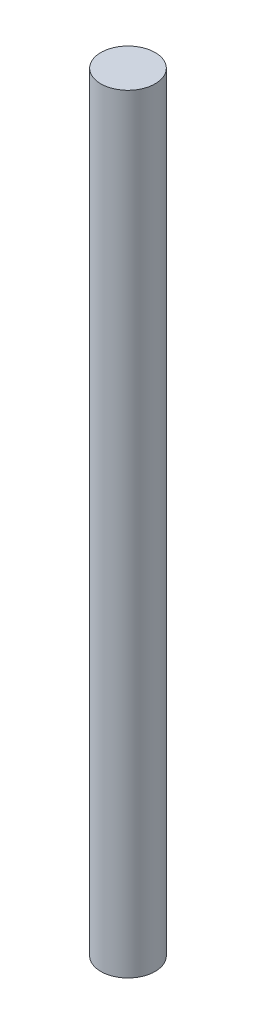
from build123d import *

# Parameters (mm, degrees)
SKETCH1_R           = 6
BOSS_EXTRUDE1_DEPTH = 170


with BuildPart() as part:
    # Sketch1 → Boss-Extrude1 (new body)
    with BuildSketch(Plane(origin=(0, 0, 0), x_dir=(1, 0, 0), z_dir=(0, 1, 0))):
        Circle(SKETCH1_R)
    extrude(amount=BOSS_EXTRUDE1_DEPTH)


solid = part.part
